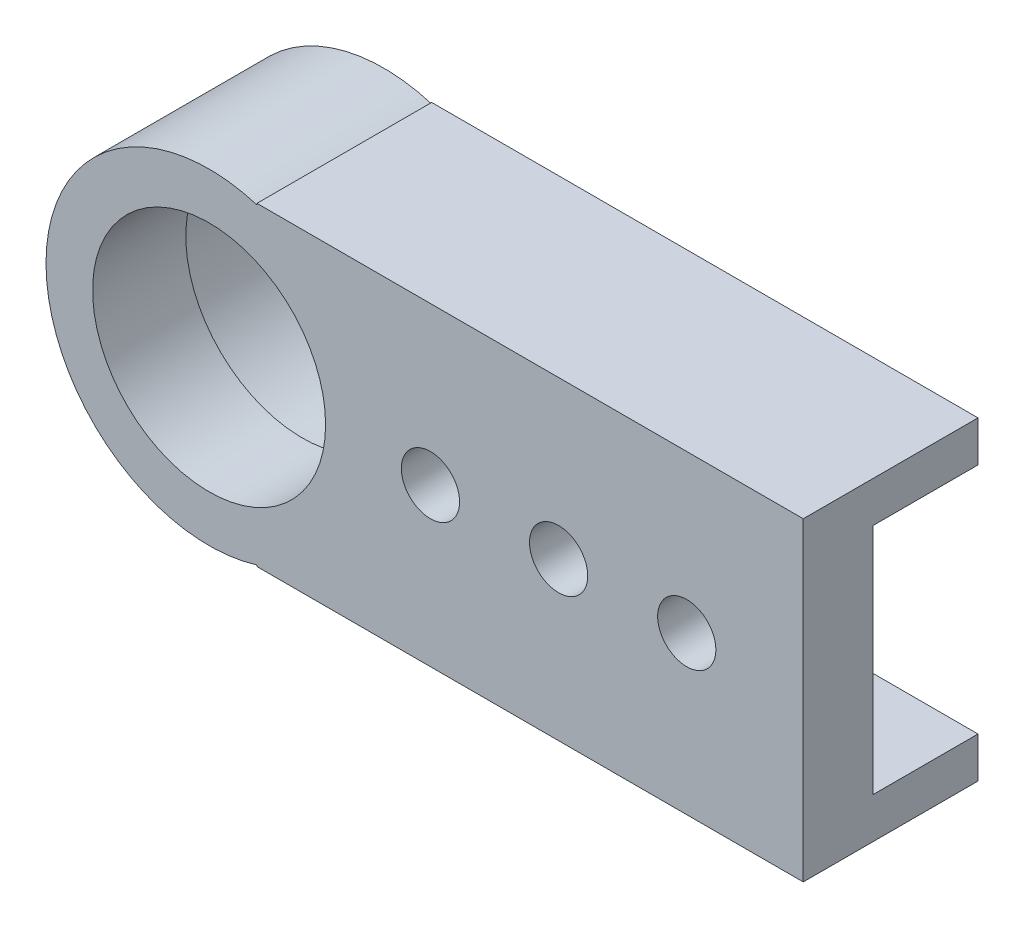
from build123d import *

# Parameters (mm, degrees)
SKETCH_1_W          = 40
SKETCH_1_H          = 20
EXTRUDE_1_DEPTH     = 6
SKETCH_2_R          = 2.5
CUT_EXTRUDE_1_DEPTH = 24.151673806
SKETCH_3_R          = 11
EXTRUDE_2_DEPTH     = 15
SKETCH_5_R          = 11
SKETCH_5_R_2        = 10
EXTRUDE_3_DEPTH     = 8


with BuildPart() as part:
    # 草图1 → 凸台-拉伸1 (new body)
    with BuildSketch(Plane.XY):
        Rectangle(SKETCH_1_W, SKETCH_1_H)
    extrude(amount=EXTRUDE_1_DEPTH)

    # 草图2 → 切除-拉伸1 (cut, through all)
    with BuildSketch(Plane.XY.offset(6)):
        with Locations((10, 0)):
            Circle(SKETCH_2_R)
        with Locations((-1, 0)):
            Circle(SKETCH_2_R)
        with Locations((-12, 0)):
            Circle(SKETCH_2_R)
    extrude(amount=-CUT_EXTRUDE_1_DEPTH, mode=Mode.SUBTRACT)

    # 草图3 → 凸台-拉伸2 (add)
    with BuildSketch(Plane.XY.offset(6)):
        with BuildLine():
            Line((20, 10), (20, 13.5))
            Line((20, 13.5), (-26.893967141, 13.5))
            Line((-26.893967141, 13.5), (-26.893967141, 13.384337644))
            ThreePointArc((-26.893967141, 13.384337644), (-45, 0), (-26.893967141, -13.384337644))
            Line((-26.893967141, -13.384337644), (-26.893967141, -13.5))
            Line((-26.893967141, -13.5), (20, -13.5))
            Line((20, -13.5), (20, -10))
            Line((20, -10), (-20, -10))
            Line((-20, -10), (-20, -8.660254038))
            ThreePointArc((-20, -8.660254038), (-17, 0), (-20, 8.660254038))
            Line((-20, 8.660254038), (-20, 10))
            Line((-20, 10), (20, 10))
        make_face()
        with Locations((-31, 0)):
            Circle(SKETCH_3_R, mode=Mode.SUBTRACT)
    extrude(amount=-EXTRUDE_2_DEPTH)

    # 草图5 → 凸台-拉伸3 (add)
    with BuildSketch(Plane.XY.offset(6)):
        with Locations((-31, 0)):
            Circle(SKETCH_5_R)
        with Locations((-31, 0)):
            Circle(SKETCH_5_R_2, mode=Mode.SUBTRACT)
    extrude(amount=-EXTRUDE_3_DEPTH)


solid = part.part
